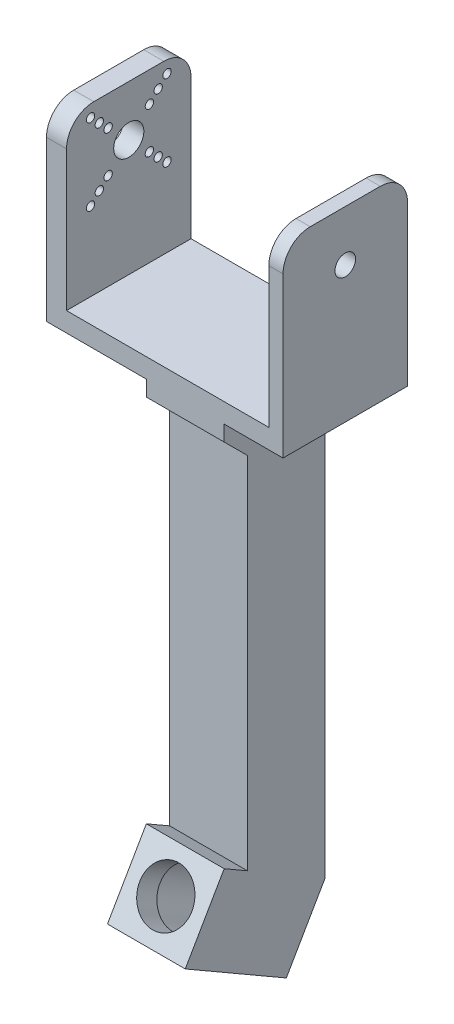
from build123d import *

# Parameters (mm, degrees)
SKETCH1_W           = 77.5
SKETCH1_H           = 77.5
SKETCH1_R           = 1.83
SKETCH1_R_2         = 13.5
BOSS_EXTRUDE1_DEPTH = 2.5
FILLET1_R           = 3
SKETCH2_W           = 5.15
SKETCH2_H           = 32
SKETCH2_W_2         = 3.65
BOSS_EXTRUDE2_DEPTH = 43
SKETCH3_R           = 3.875
SKETCH3_R_2         = 1.075
CUT_EXTRUDE1_DEPTH  = 10
SKETCH4_R           = 2.65
CUT_EXTRUDE2_DEPTH  = 10
SKETCH5_R           = 3.875
SKETCH5_R_2         = 2.65
BOSS_EXTRUDE3_DEPTH = 1.5
CHAMFER1_SIZE       = 1.5
SKETCH1_3_W         = 77.5
SKETCH1_3_H         = 77.5
SKETCH1_3_R         = 1.83
SKETCH1_3_R_2       = 13.5
CUT_EXTRUDE4_DEPTH  = 2.5
SKETCH6_W           = 60.8
SKETCH6_H           = 32
SKETCH6_W_2         = 30
BOSS_EXTRUDE4_DEPTH = 5
SKETCH7_W           = 20
SKETCH7_H           = 20
BOSS_EXTRUDE5_DEPTH = 114
BOSS_EXTRUDE7_DEPTH = 20
SKETCH10_R          = 8.25
CUT_EXTRUDE6_DEPTH  = 30
SKETCH11_R          = 8.25
SKETCH11_R_2        = 6.7
BOSS_EXTRUDE8_DEPTH = 6
FILLET3_R           = 7
CHAMFER2_SIZE       = 10


# Some blends are built 0.0001 mm under size
with BuildPart() as part:
    # Sketch1 → Boss-Extrude1 (new body)
    with BuildSketch(Plane(origin=(0, 0, 0), x_dir=(1, 0, 0), z_dir=(0, 1, 0))):
        Rectangle(SKETCH1_W, SKETCH1_H)
        with Locations(Location((32.75, 32.75, 0), (0, 0, 270))):
            Circle(SKETCH1_R, mode=Mode.SUBTRACT)
        with Locations(Location((32.75, -32.75, 0), (0, 0, 270))):
            Circle(SKETCH1_R, mode=Mode.SUBTRACT)
        with Locations(Location((-32.75, -32.75, 0), (0, 0, 270))):
            Circle(SKETCH1_R, mode=Mode.SUBTRACT)
        with Locations(Location((-32.75, 32.75, 0), (0, 0, 270))):
            Circle(SKETCH1_R, mode=Mode.SUBTRACT)
        with Locations(Location((0, 0, 0), (0, 0, 270))):
            Circle(SKETCH1_R_2, mode=Mode.SUBTRACT)
    extrude(amount=BOSS_EXTRUDE1_DEPTH)

    # Fillet1
    fillet1_edges = [part.edges().sort_by_distance(p)[0] for p in [
        (38.75, 1.25, 38.75),
        (-38.75, 1.25, 38.75),
        (-38.75, 1.25, -38.75),
        (38.75, 1.25, -38.75),
    ]]
    fillet(fillet1_edges, radius=FILLET1_R)

    # Sketch2 → Boss-Extrude2 (add)
    with BuildSketch(Plane(origin=(0, 2.5, 0), x_dir=(1, 0, 0), z_dir=(0, 1, 0))):
        with Locations((-33.075, 0)):
            Rectangle(SKETCH2_W, SKETCH2_H)
        with Locations((23.325, 0)):
            Rectangle(SKETCH2_W_2, SKETCH2_H)
    extrude(amount=BOSS_EXTRUDE2_DEPTH)

    # Sketch3 → Cut-Extrude1 (cut)
    with BuildSketch(Plane.ZY.offset(35.65)):
        with Locations((0, 32.5)):
            Circle(SKETCH3_R)
        with Locations((-5.303300859, 37.803300859)):
            Circle(SKETCH3_R_2)
        with Locations((5.303300859, 37.803300859)):
            Circle(SKETCH3_R_2)
        with Locations((5.303300859, 27.196699141)):
            Circle(SKETCH3_R_2)
        with Locations((-5.303300859, 27.196699141)):
            Circle(SKETCH3_R_2)
        with Locations((-7.566042559, 40.066042559)):
            Circle(SKETCH3_R_2)
        with Locations((-9.828784258, 42.328784258)):
            Circle(SKETCH3_R_2)
        with Locations((9.828784258, 42.328784258)):
            Circle(SKETCH3_R_2)
        with Locations((7.566042559, 40.066042559)):
            Circle(SKETCH3_R_2)
        with Locations((9.828784258, 22.671215742)):
            Circle(SKETCH3_R_2)
        with Locations((7.566042559, 24.933957441)):
            Circle(SKETCH3_R_2)
        with Locations((-9.828784258, 22.671215742)):
            Circle(SKETCH3_R_2)
        with Locations((-7.566042559, 24.933957441)):
            Circle(SKETCH3_R_2)
    extrude(amount=-CUT_EXTRUDE1_DEPTH, mode=Mode.SUBTRACT)

    # Sketch4 → Cut-Extrude2 (cut)
    with BuildSketch(Plane(origin=(25.15, 0, 0), x_dir=(0, 0, -1), z_dir=(1, 0, 0))):
        with Locations((0, 32.5)):
            Circle(SKETCH4_R)
    extrude(amount=-CUT_EXTRUDE2_DEPTH, mode=Mode.SUBTRACT)

    # Sketch5 → Boss-Extrude3 (add)
    with BuildSketch(Plane.ZY.offset(-21.5)):
        with Locations((0, 32.5)):
            Circle(SKETCH5_R)
        with Locations(Location((0, 32.5, 0), (0, 0, 180))):
            Circle(SKETCH5_R_2, mode=Mode.SUBTRACT)
    extrude(amount=BOSS_EXTRUDE3_DEPTH)

    # Chamfer1
    chamfer1_edges = [part.edges().sort_by_distance(p)[0] for p in [
        (21.5, 32.5, -3.875),
    ]]
    chamfer(chamfer1_edges, length=CHAMFER1_SIZE - 0.0001)  # a hair under: the kernel refuses the full size

    # Sketch1<3> → Cut-Extrude4 (cut)
    with BuildSketch(Plane(origin=(0, 0, 0), x_dir=(1, 0, 0), z_dir=(0, 1, 0))):
        Rectangle(SKETCH1_3_W, SKETCH1_3_H)
        with Locations((32.75, 32.75)):
            Circle(SKETCH1_3_R, mode=Mode.SUBTRACT)
        with Locations((32.75, -32.75)):
            Circle(SKETCH1_3_R, mode=Mode.SUBTRACT)
        with Locations((-32.75, -32.75)):
            Circle(SKETCH1_3_R, mode=Mode.SUBTRACT)
        with Locations((-32.75, 32.75)):
            Circle(SKETCH1_3_R, mode=Mode.SUBTRACT)
        Circle(SKETCH1_3_R_2, mode=Mode.SUBTRACT)
    extrude(amount=CUT_EXTRUDE4_DEPTH, mode=Mode.SUBTRACT)


with BuildPart() as cut_extrude4_piece_1:
    # of the separate pieces the step leaves, piece 1, a body of its own (cut_extrude4_pieces)
    add(part.part.solids().sort_by_distance((-35.65, 2.5, 16))[0])



with BuildPart() as cut_extrude4_piece_2:
    # of the separate pieces the step leaves, piece 2, a body of its own (cut_extrude4_pieces)
    add(part.part.solids().sort_by_distance((21.5, 32.5, 5.3749))[0])


with BuildPart() as cut_extrude4_piece_1_1:
    add(cut_extrude4_piece_1.part)

    add(cut_extrude4_piece_2.part)  # Boss-Extrude4 merges Cut-Extrude4 piece 2
    # Sketch6 → Boss-Extrude4 (add)
    with BuildSketch(Plane.XZ.offset(-2.5)):
        with Locations((-5.25, 0)):
            Rectangle(SKETCH6_W, SKETCH6_H)
        Rectangle(SKETCH6_W_2, SKETCH6_H)
    extrude(amount=BOSS_EXTRUDE4_DEPTH)

    # Sketch7 → Boss-Extrude5 (add)
    with BuildSketch(Plane.XZ.offset(2.5)):
        Rectangle(SKETCH7_W, SKETCH7_H)
    extrude(amount=BOSS_EXTRUDE5_DEPTH)

    # Sketch8 → Boss-Extrude7 (add)
    with BuildSketch(Plane.ZY.offset(-10)):
        Polygon((-10, -116.5), (0, -133.820508076), (25.980762114, -118.820508076), (15.980762114, -101.5), align=None)
    extrude(amount=BOSS_EXTRUDE7_DEPTH)

    # Sketch10 → Cut-Extrude6 (cut)
    with BuildSketch(Plane(origin=(0, -33.455127019, -57.94597977), x_dir=(-1, 0, 0), z_dir=(0, -0.49999999999999845, -0.8660254037844396))):
        with Locations(Location((0, -105.891959541, 0), (0, 0, 90))):
            Circle(SKETCH10_R)
    extrude(amount=-CUT_EXTRUDE6_DEPTH, mode=Mode.SUBTRACT)

    # Sketch11 → Boss-Extrude8 (add)
    with BuildSketch(Plane(origin=(0, -18.455127019, -31.965217657), x_dir=(1, 0, 0), z_dir=(0, 0.49999999999999845, 0.8660254037844396))):
        with Locations(Location((0, -105.891959541, 0), (0, 0, 90))):
            Circle(SKETCH11_R)
        with Locations(Location((0, -105.891959541, 0), (0, 0, 270))):
            Circle(SKETCH11_R_2, mode=Mode.SUBTRACT)
    extrude(amount=-BOSS_EXTRUDE8_DEPTH)

    # Fillet3
    fillet3_edges = [cut_extrude4_piece_1_1.edges().sort_by_distance(p)[0] for p in [
        (23.325, 45.5, 16),
        (23.325, 45.5, -16),
        (-33.075, 45.5, 16),
        (-33.075, 45.5, -16),
    ]]
    fillet(fillet3_edges, radius=FILLET3_R)

    # Chamfer2
    # the kernel refuses this chamfer: 10 mm, written as the material it adds along each edge
    with BuildSketch(Plane(origin=(-10, -2.5, 10), x_dir=(0, 0.027495876610586358, 0.9996219169112968), z_dir=(1, 0, 0))) as chamfer2_piece_1_section:
        Polygon((CHAMFER2_SIZE * 0.999621916911, CHAMFER2_SIZE * 0.0274958766106), (-CHAMFER2_SIZE * 0.0274958766106, CHAMFER2_SIZE * 0.999621916911), (0, 0), align=None)
    chamfer2_piece_1 = extrude(amount=20, mode=Mode.PRIVATE)
    chamfer2_piece_1 = split(chamfer2_piece_1, bisect_by=Plane(origin=(0, -6.250094595, 16), z_dir=(0, 0, -1)), keep=Keep.TOP, mode=Mode.PRIVATE)
    add(chamfer2_piece_1)
    with BuildSketch(Plane(origin=(10, -2.5, -10), x_dir=(0, 0.027495876610586365, -0.9996219169112968), z_dir=(-1, 0, 0))) as chamfer2_piece_2_section:
        Polygon((CHAMFER2_SIZE * 0.999621916911, CHAMFER2_SIZE * 0.0274958766106), (-CHAMFER2_SIZE * 0.0274958766106, CHAMFER2_SIZE * 0.999621916911), (0, 0), align=None)
    chamfer2_piece_2 = extrude(amount=20, mode=Mode.PRIVATE)
    chamfer2_piece_2 = split(chamfer2_piece_2, bisect_by=Plane(origin=(0, -6.250094595, -16), z_dir=(0, 0, 1)), keep=Keep.TOP, mode=Mode.PRIVATE)
    add(chamfer2_piece_2)


solid = cut_extrude4_piece_1_1.part
